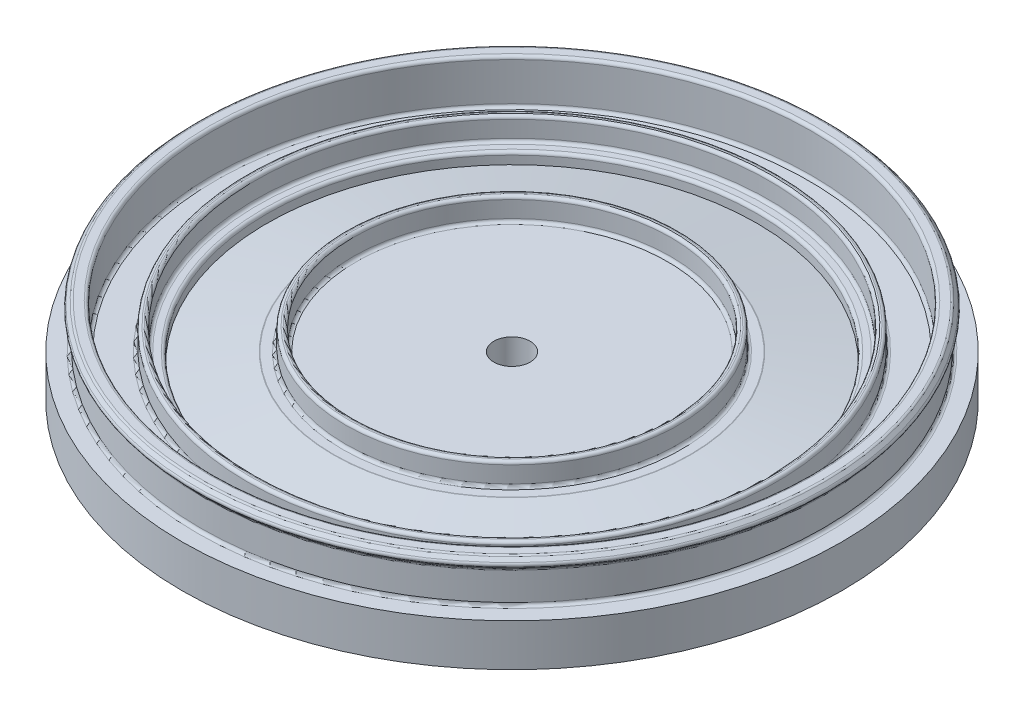
from build123d import *

# Parameters (mm, degrees)
SKETCH2_R           = 54.5
BOSS_EXTRUDE1_DEPTH = 7
SKETCH4_R           = 43.75
SKETCH4_R_2         = 42.5
SKETCH4_R_3         = 27.5
SKETCH4_R_4         = 26.25
BOSS_EXTRUDE2_DEPTH = 3.723
FILLET1_R           = 0.5
FILLET2_R           = 0.5
SKETCH6_R           = 3
CUT_EXTRUDE1_DEPTH  = 6


with BuildPart() as part:
    # Sketch2 → Boss-Extrude1 (new body)
    with BuildSketch(Plane(origin=(0, 0, 0), x_dir=(1, 0, 0), z_dir=(0, 1, 0))):
        Circle(SKETCH2_R)
    extrude(amount=BOSS_EXTRUDE1_DEPTH)

    # Sketch3 → Cut-Revolve1 (revolve, cut)
    with BuildSketch(Plane.XY):
        Polygon((-29.5, 7), (-40.5, 7), (-40.5, 5.127), align=None)
    revolve(axis=Axis((0, 0, 0), (0, 1, 0)), mode=Mode.SUBTRACT)

    # Sketch4 → Boss-Extrude2 (add)
    # profile 1 of 2: a face of its own
    with BuildSketch(Plane(origin=(0, 7, 0), x_dir=(1, 0, 0), z_dir=(0, 1, 0))):
        Circle(SKETCH4_R)
        Circle(SKETCH4_R_2, mode=Mode.SUBTRACT)
    # profile 2 of 2: a face of its own
    with BuildSketch(Plane(origin=(0, 7, 0), x_dir=(1, 0, 0), z_dir=(0, 1, 0))):
        Circle(SKETCH4_R_3)
        Circle(SKETCH4_R_4, mode=Mode.SUBTRACT)
    extrude(amount=BOSS_EXTRUDE2_DEPTH)

    # Fillet1
    fillet1_edges = [part.edges().sort_by_distance(p)[0] for p in [
        (-26.25, 7, 0),
        (29.5, 7, 0),
        (40.5, 7, 0),
        (-43.75, 10.723, 0),
        (-42.5, 7, 0),
        (-42.5, 10.723, 0),
        (-27.5, 7, 0),
        (-27.5, 10.723, 0),
        (-26.25, 10.723, 0),
        (-43.75, 7, 0),
    ]]
    fillet(fillet1_edges, radius=FILLET1_R)

    # Sketch5 → Revolve1 (revolve)
    with BuildSketch(Plane.XY):
        Polygon((-49.5, 7), (-51.5, 7), (-51.5, 12.323), (-52.5, 13.323), (-51.5, 14.323), (-49.5, 14.323), align=None)
    revolve(axis=Axis((0, 7, 0), (0, 1, 0)))

    # Fillet2
    fillet2_edges = [part.edges().sort_by_distance(p)[0] for p in [
        (51.5, 7, 0),
        (49.5, 7, 0),
        (49.5, 14.323, 0),
        (51.5, 14.323, 0),
        (51.5, 12.323, 0),
        (52.5, 13.323, 0),
    ]]
    fillet(fillet2_edges, radius=FILLET2_R)

    # Sketch6 → Cut-Extrude1 (cut)
    with BuildSketch(Plane(origin=(0, 7, 0), x_dir=(1, 0, 0), z_dir=(0, 1, 0))):
        Circle(SKETCH6_R)
    extrude(amount=-CUT_EXTRUDE1_DEPTH, mode=Mode.SUBTRACT)


solid = part.part
